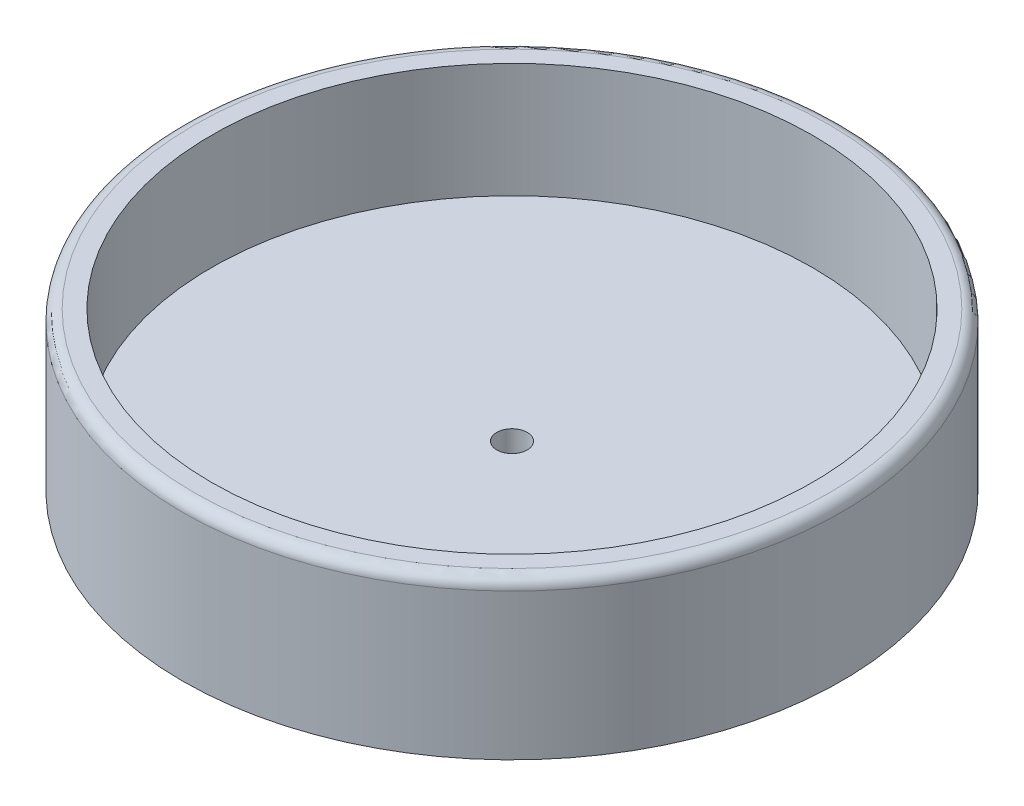
from build123d import *

# Parameters (mm, degrees)
SKETCH1_R                                           = 73.025
BOSS_EXTRUDE1_DEPTH                                 = 9.525
SKETCH2_R                                           = 73.025
SKETCH2_R_2                                         = 66.6115
BOSS_EXTRUDE2_DEPTH                                 = 25.4
CSK_FOR_1_4_FLAT_HEAD_MACHINE_SCREW_100_D           = 6.7564
CSK_FOR_1_4_FLAT_HEAD_MACHINE_SCREW_100_DEPTH       = 10.16
CSK_FOR_1_4_FLAT_HEAD_MACHINE_SCREW_100_CSINK_D     = 15.24
CSK_FOR_1_4_FLAT_HEAD_MACHINE_SCREW_100_CSINK_ANGLE = 100
CSK_FOR_1_4_FLAT_HEAD_MACHINE_SCREW_100_TIP         = 2.029827343
FILLET1_R                                           = 2.54


with BuildPart() as part:
    # Sketch1 → Boss-Extrude1 (new body)
    with BuildSketch(Plane(origin=(0, 0, 0), x_dir=(1, 0, 0), z_dir=(0, 1, 0))):
        Circle(SKETCH1_R)
    extrude(amount=BOSS_EXTRUDE1_DEPTH)

    # Sketch2 → Boss-Extrude2 (add)
    with BuildSketch(Plane(origin=(0, 9.525, 0), x_dir=(1, 0, 0), z_dir=(0, 1, 0))):
        Circle(SKETCH2_R)
        Circle(SKETCH2_R_2, mode=Mode.SUBTRACT)
    extrude(amount=BOSS_EXTRUDE2_DEPTH)

    # CSK for 1/4 Flat Head Machine Screw (100)1
    with Locations(Plane(origin=(0, 0, 0), x_dir=(-1, 0, 0), z_dir=(0, -1, 0))):
        with Locations((0, 0)):
            CounterSinkHole(CSK_FOR_1_4_FLAT_HEAD_MACHINE_SCREW_100_D / 2, CSK_FOR_1_4_FLAT_HEAD_MACHINE_SCREW_100_CSINK_D / 2, depth=CSK_FOR_1_4_FLAT_HEAD_MACHINE_SCREW_100_DEPTH, counter_sink_angle=CSK_FOR_1_4_FLAT_HEAD_MACHINE_SCREW_100_CSINK_ANGLE)
            with Locations((0, 0, -(CSK_FOR_1_4_FLAT_HEAD_MACHINE_SCREW_100_DEPTH + CSK_FOR_1_4_FLAT_HEAD_MACHINE_SCREW_100_TIP / 2))):  # 118° drill point
                Cone(0, CSK_FOR_1_4_FLAT_HEAD_MACHINE_SCREW_100_D / 2, CSK_FOR_1_4_FLAT_HEAD_MACHINE_SCREW_100_TIP, mode=Mode.SUBTRACT)

    # Fillet1
    fillet1_edges = [part.edges().sort_by_distance(p)[0] for p in [
        (-73.025, 34.925, 0),
    ]]
    fillet(fillet1_edges, radius=FILLET1_R)


solid = part.part
